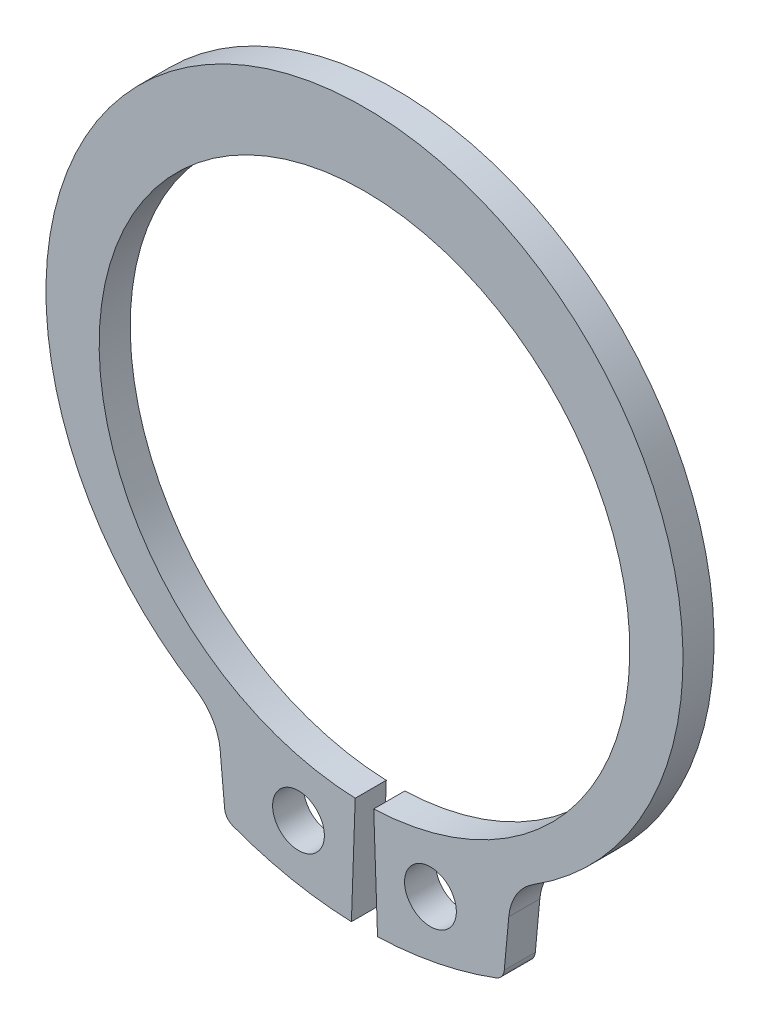
from build123d import *

# Parameters (mm, degrees)
SKETCH1_R            = 1
BOSS_EXTRUDE1_DEPTH  = 1.2
FILLET1_R            = 2.07
FILLET4_R            = 0.49
FILLET1_OF_MIRROR1_R = 2.07
FILLET4_OF_MIRROR1_R = 0.49


with BuildPart() as part:
    # Sketch1 → Boss-Extrude1 (new body)
    with BuildSketch(Plane.XY):
        with BuildLine():
            Line((0, 14.048289211), (0, 11.248289211))
            ThreePointArc((0, 11.248289211), (-10.248438875, 1.177176377), (-0.357719841, -9.245466766))
            Line((-0.357719841, -9.245466766), (-0.504605119, -13.451710789))
            ThreePointArc((-0.504605119, -13.451710789), (-2.98312755, -13.149434151), (-5.372687964, -12.425247967))
            Line((-5.372687964, -12.425247967), (-5.673899028, -9.176649109))
            ThreePointArc((-5.673899028, -9.176649109), (-11.953983543, 4.663129756), (0, 14.048289211))
        make_face()
        with Locations((-2.548948919, -11.090306925)):
            Circle(SKETCH1_R, mode=Mode.SUBTRACT)
    boss_extrude1 = extrude(amount=BOSS_EXTRUDE1_DEPTH)

    # Fillet1
    fillet1_edges = [part.edges().sort_by_distance(p)[0] for p in [
        (-5.673899028, -9.176649109, 0.6),
    ]]
    fillet(fillet1_edges, radius=FILLET1_R)

    # Fillet4
    fillet4_edges = [part.edges().sort_by_distance(p)[0] for p in [
        (-5.372687964, -12.425247967, 0.6),
    ]]
    fillet(fillet4_edges, radius=FILLET4_R)

    # Mirror1: Boss-Extrude1 across plane
    add(boss_extrude1.mirror(Plane(origin=(0, 14.048289211, 1.2), x_dir=(0, 0, 1), z_dir=(-1, 0, 0))))

    # Fillet1 of Mirror1
    fillet1_of_mirror1_edges = [part.edges().sort_by_distance(p)[0] for p in [
        (5.673899028, -9.176649109, 0.6),
    ]]
    fillet(fillet1_of_mirror1_edges, radius=FILLET1_OF_MIRROR1_R)

    # Fillet4 of Mirror1
    fillet4_of_mirror1_edges = [part.edges().sort_by_distance(p)[0] for p in [
        (5.372687964, -12.425247967, 0.6),
    ]]
    fillet(fillet4_of_mirror1_edges, radius=FILLET4_OF_MIRROR1_R)


solid = part.part
